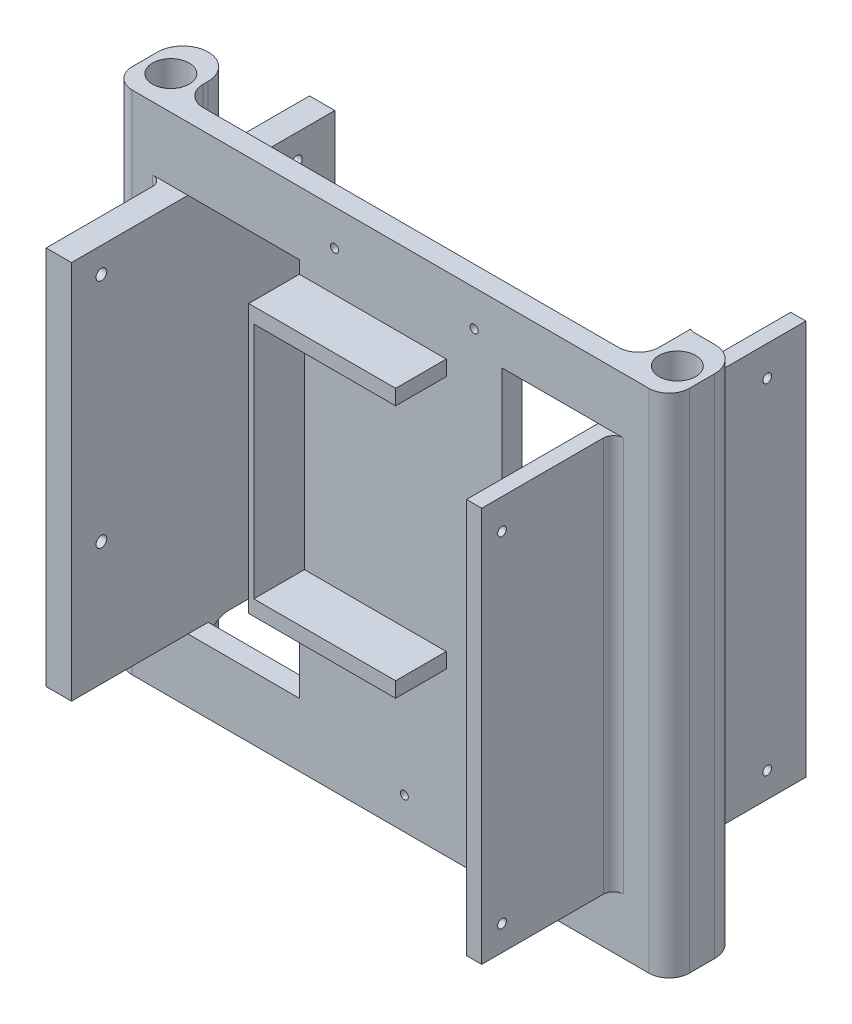
from build123d import *

# Parameters (mm, degrees)
BOSS_EXTRUDE1_DEPTH      = 127
SKETCH3_R                = 4.60374999999995
SKETCH3_R_2              = 4.603749999999996
CUT_EXTRUDE1_DEPTH       = 127
CUT_EXTRUDE10_DEPTH      = 190.225738207042
CUT_EXTRUDE10_DEPTH_BACK = 190.225738207042
SKETCH19_W               = 27.939999999999998
SKETCH19_H               = 99.05999999999997
BOSS_EXTRUDE6_DEPTH      = 3.8099999999999996
CUT_EXTRUDE11_DEPTH      = 183.54455346572246
CUT_EXTRUDE11_DEPTH_BACK = 183.54455346572246
SKETCH23_R               = 1.0999978000000017
SKETCH23_R_2             = 1.0999978000000061
SKETCH23_R_3             = 1.099997799999995
BOSS_EXTRUDE8_DEPTH      = 31.75
BOSS_EXTRUDE8_DEPTH_BACK = 34.29
CUT_EXTRUDE12_DEPTH      = 194.67395901359583
CUT_EXTRUDE12_DEPTH_BACK = 194.67395901359583
CUT_EXTRUDE13_DEPTH      = 194.67395901359583
CUT_EXTRUDE13_DEPTH_BACK = 194.67395901359583
SKETCH32_R               = 0.9999980000000093
SKETCH34_R               = 1.3499972999999863
SKETCH34_R_2             = 1.349997299999995
SKETCH34_R_3             = 1.3499973000000016
CUT_EXTRUDE15_DEPTH      = 15.239999999999998
BOSS_EXTRUDE10_DEPTH     = 12.7
SKETCH36_W               = 1.2700000000000102
SKETCH36_H               = 12.700000000000014
BOSS_EXTRUDE11_DEPTH     = 99.06
FILLET5_R                = 2.54
FILLET6_R                = 2.54
FILLET7_R                = 5.08


with BuildPart() as part:
    # Sketch2 → Boss-Extrude1 (new body)
    with BuildSketch(Plane(origin=(0, 0, 0), x_dir=(1, 0, 0), z_dir=(0, 1, 0))):
        with BuildLine():
            Line((8.7e-16, 11.429999999999996), (8.7e-16, 5.079999999999999))
            ThreePointArc((8.7e-16, 5.079999999999999), (1.4878975515723396, 1.4878975515723383), (5.080000000000001, 0))
            Line((5.080000000000001, 0), (134.61999999999998, 0))
            ThreePointArc((134.61999999999998, 0), (138.21210244842763, 1.4878975515723387), (139.7, 5.08))
            Line((139.7, 5.08), (139.70000000000002, 11.429999999999996))
            ThreePointArc((139.70000000000002, 11.429999999999996), (137.8401280605346, 15.920128060534589), (133.35, 17.78000000000002))
            Line((133.35, 17.78000000000002), (127, 17.780000000000015))
            Line((127, 17.780000000000015), (127, 11.429999999999996))
            Line((127, 11.429999999999996), (127, 5.079999999999999))
            Line((127, 5.079999999999999), (12.699999999999989, 5.08))
            Line((12.699999999999989, 5.08), (12.699999999999989, 11.429999999999996))
            ThreePointArc((12.699999999999989, 11.429999999999996), (6.349999999999994, 17.77999999999999), (8.7e-16, 11.429999999999996))
        make_face()
    extrude(amount=BOSS_EXTRUDE1_DEPTH)

    # Sketch3 → Cut-Extrude1 (cut)
    with BuildSketch(Plane(origin=(0, 127, 0), x_dir=(1, 0, 0), z_dir=(0, 1, 0))):
        with Locations(Location((133.35, 8.41375, 0), (0, 0, 270))):
            Circle(SKETCH3_R)
        with Locations(Location((6.349999999999994, 8.41375, 0), (0, 0, 270))):
            Circle(SKETCH3_R_2)
    extrude(amount=-CUT_EXTRUDE1_DEPTH, mode=Mode.SUBTRACT)

    # Sketch19 → Cut-Extrude10 (cut, two sides: drawn at the far end of the back side and taken through both)
    with BuildSketch(Plane(origin=(4e-17, 0, -5.08), x_dir=(-1, 0, -1e-17), z_dir=(1e-17, 0, -1)).offset(-CUT_EXTRUDE10_DEPTH_BACK)):
        with Locations((-111.76, 63.5)):
            Rectangle(SKETCH19_W, SKETCH19_H)
    extrude(amount=CUT_EXTRUDE10_DEPTH + CUT_EXTRUDE10_DEPTH_BACK, mode=Mode.SUBTRACT)

    # Sketch20 → Boss-Extrude6 (add)
    with BuildSketch(Plane(origin=(125.73, 0, 9.5e-16), x_dir=(1e-17, 0, -1), z_dir=(1, 0, 1e-17))):
        Polygon((5.08, 113.02999999999999), (48.26, 113.02999999999999), (48.26000000000001, 13.97000000000001), (5.08, 13.97000000000001), (-1.06e-15, 13.97000000000001), (-33.01999999999999, 13.97000000000001), (-33.02, 113.02999999999999), (-1.06e-15, 113.02999999999999), align=None)
    extrude(amount=-BOSS_EXTRUDE6_DEPTH)

    # Sketch23 → Cut-Extrude11 (cut, two sides: drawn at the far end of the back side and taken through both)
    with BuildSketch(Plane.ZY.offset(-121.92000000000002).offset(-CUT_EXTRUDE11_DEPTH_BACK)):
        with Locations((27.94, 105.45831715747836)):
            Circle(SKETCH23_R)
        with Locations((27.94, 20.32000000000001)):
            Circle(SKETCH23_R_2)
        with Locations((-38.55999400000001, 20.32000000000001)):
            Circle(SKETCH23_R_3)
        with Locations((-38.55999400000001, 105.45831715747836)):
            Circle(SKETCH23_R_3)
    extrude(amount=CUT_EXTRUDE11_DEPTH + CUT_EXTRUDE11_DEPTH_BACK, mode=Mode.SUBTRACT)

    # Sketch26 → Boss-Extrude8 (add, two sides: drawn at the far end of the back side and taken through both)
    with BuildSketch(Plane(origin=(4e-17, 0, -5.08), x_dir=(-1, 0, -1e-17), z_dir=(1e-17, 0, -1)).offset(-BOSS_EXTRUDE8_DEPTH_BACK)):
        Polygon((-19.049999999999976, 111.125), (-12.699999999999976, 111.125), (-12.699999999999976, 15.875), (-19.049999999999955, 15.875), align=None)
    extrude(amount=BOSS_EXTRUDE8_DEPTH + BOSS_EXTRUDE8_DEPTH_BACK)

    # Sketch27 → Cut-Extrude12 (cut, two sides: drawn at the far end of the back side and taken through both)
    with BuildSketch(Plane(origin=(4e-17, 0, -5.08), x_dir=(-1, 0, -1e-17), z_dir=(1e-17, 0, -1)).offset(-CUT_EXTRUDE12_DEPTH_BACK)):
        Polygon((-19.049999999999976, 15.875), (-46.989999999999974, 15.874999999999996), (-46.989999999999974, 111.125), (-19.049999999999976, 111.125), align=None)
    extrude(amount=CUT_EXTRUDE12_DEPTH + CUT_EXTRUDE12_DEPTH_BACK, mode=Mode.SUBTRACT)

    # Sketch32 → Cut-Extrude13 (cut, two sides: drawn at the far end of the back side and taken through both)
    with BuildSketch(Plane(origin=(4e-17, 0, -5.08), x_dir=(-1, 0, -1e-17), z_dir=(1e-17, 0, -1)).offset(-CUT_EXTRUDE13_DEPTH_BACK)):
        with Locations((-90.80499999999999, 118.02000779999999)):
            Circle(SKETCH32_R)
        with Locations((-55.8049938, 118.02000779999999)):
            Circle(SKETCH32_R)
        with Locations((-55.8049938, 33.02)):
            Circle(SKETCH32_R)
        with Locations((-90.80499999999999, 33.02)):
            Circle(SKETCH32_R)
        with Locations((-73.3049969, 8.019999200000003)):
            Circle(SKETCH32_R)
    extrude(amount=CUT_EXTRUDE13_DEPTH + CUT_EXTRUDE13_DEPTH_BACK, mode=Mode.SUBTRACT)

    # Sketch34 → Cut-Extrude15 (cut)
    with BuildSketch(Plane.ZY.offset(-12.699999999999976)):
        with Locations(Location((-27.30500000000001, 104.775, 0), (0, 0, 270))):
            Circle(SKETCH34_R)
        with Locations(Location((21.695003599999986, 104.775, 0), (0, 0, 270))):
            Circle(SKETCH34_R)
        with Locations(Location((21.695003599999993, 46.774989000000026, 0), (0, 0, 270))):
            Circle(SKETCH34_R_2)
        with Locations(Location((-27.305000000000003, 46.77498900000001, 0), (0, 0, 270))):
            Circle(SKETCH34_R_3)
    extrude(amount=-CUT_EXTRUDE15_DEPTH, mode=Mode.SUBTRACT)

    # Sketch35 → Boss-Extrude10 (add)
    with BuildSketch(Plane.XY):
        Polygon((48.25999999999998, 104.14154915842353), (48.259999999999984, 44.45154915842352), (83.81999999999998, 44.451549158423525), (83.81999999999998, 40.64154915842352), (46.989999999999974, 40.641549158423516), (46.989999999999974, 107.95154915842352), (83.81999999999996, 107.95154915842353), (83.81999999999996, 104.14154915842353), align=None)
    extrude(amount=BOSS_EXTRUDE10_DEPTH)

    # Sketch36 → Boss-Extrude11 (add)
    with BuildSketch(Plane.XZ.offset(-13.97000000000001)):
        with Locations((126.36500000000001, -11.430000000000009)):
            Rectangle(SKETCH36_W, SKETCH36_H)
    extrude(amount=-BOSS_EXTRUDE11_DEPTH)

    # Fillet5
    fillet5_edges = [part.edges().sort_by_distance(p)[0] for p in [
        (12.699999999999989, 63.5, -11.429999999999996),
    ]]
    fillet(fillet5_edges, radius=FILLET5_R)

    # Fillet6
    fillet6_edges = [part.edges().sort_by_distance(p)[0] for p in [
        (125.73, 63.5, 0),
        (12.699999999999976, 63.5, 0),
        (125.73, 63.500000000000014, -17.780000000000015),
    ]]
    fillet(fillet6_edges, radius=FILLET6_R)

    # Fillet7
    fillet7_edges = [part.edges().sort_by_distance(p)[0] for p in [
        (12.699999999999989, 7.9375, -5.08),
        (15.874999999999986, 111.125, -5.08),
        (15.874999999999972, 15.875, -5.08),
        (12.699999999999989, 119.0625, -5.08),
        (127, 120.01500000000001, -5.079999999999999),
        (127, 6.985000000000005, -5.079999999999999),
        (124.46000000000001, 13.97000000000001, -5.08),
        (124.46000000000001, 113.03, -5.08),
    ]]
    fillet(fillet7_edges, radius=FILLET7_R - 0.0001)  # a hair under: the kernel refuses the full size


solid = part.part
